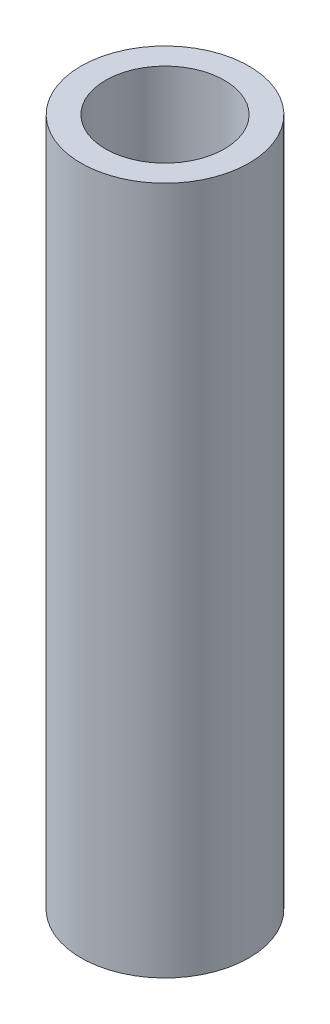
from build123d import *

# Parameters (mm, degrees)
SKETCH1_R           = 8.55
SKETCH1_R_2         = 6.05
EXTRUDE_THIN1_DEPTH = 70


with BuildPart() as part:
    # Sketch1 → Extrude-Thin1 (new body)
    with BuildSketch(Plane(origin=(0, 0, 0), x_dir=(1, 0, 0), z_dir=(0, 1, 0))):
        Circle(SKETCH1_R)
        Circle(SKETCH1_R_2, mode=Mode.SUBTRACT)
    extrude(amount=EXTRUDE_THIN1_DEPTH)


solid = part.part
